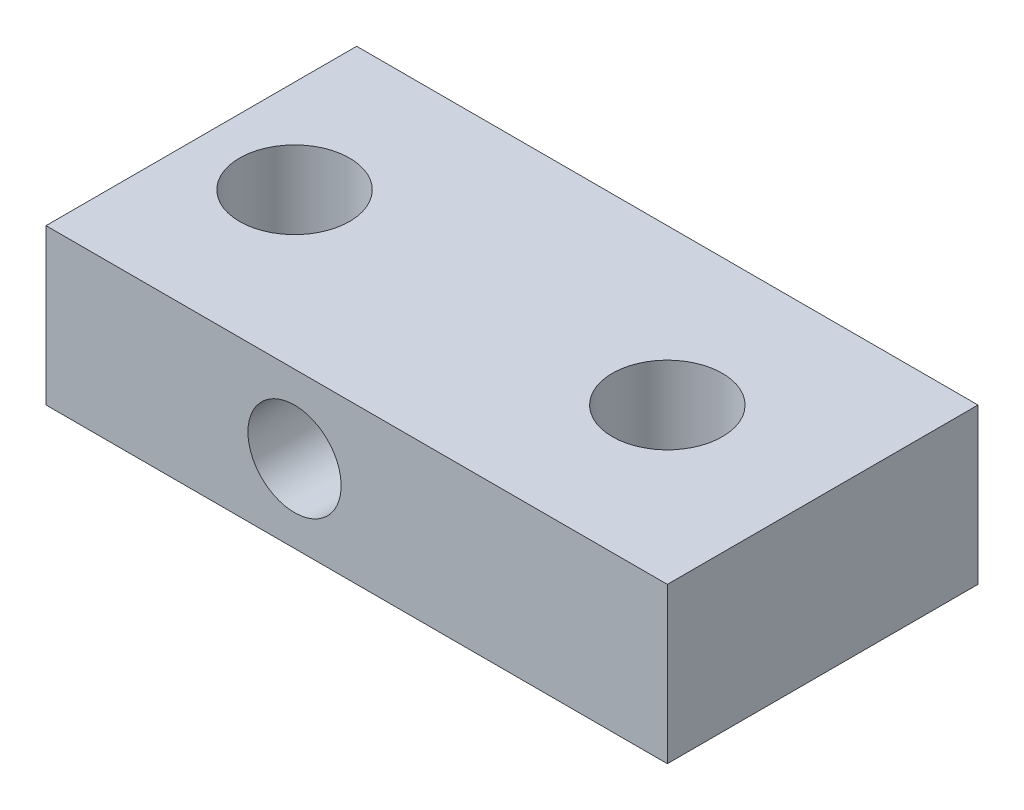
from build123d import *

# Parameters (mm, degrees)
SKETCH1_W             = 25.4
SKETCH1_H             = 12.7
BOSS_EXTRUDE1_DEPTH   = 6.35
SKETCH2_R             = 1.905
CUT_EXTRUDE1_DEPTH    = 20.05
F_8_CLEARANCE_HOLE1_D = 4.4958


with BuildPart() as part:
    # Sketch1 → Boss-Extrude1 (new body)
    with BuildSketch(Plane(origin=(0, 0, 0), x_dir=(1, 0, 0), z_dir=(0, 1, 0))):
        Rectangle(SKETCH1_W, SKETCH1_H)
    extrude(amount=BOSS_EXTRUDE1_DEPTH)

    # Sketch2 → Cut-Extrude1 (cut, through all)
    with BuildSketch(Plane(origin=(0, 0, -6.35), x_dir=(-1, 0, 0), z_dir=(0, 0, -1))):
        with Locations((2.54, 3.175)):
            Circle(SKETCH2_R)
    extrude(amount=-CUT_EXTRUDE1_DEPTH, mode=Mode.SUBTRACT)

    # #8 Clearance Hole1 (through all)
    with Locations(Plane(origin=(0, 6.35, 0), x_dir=(1, 0, 0), z_dir=(0, 1, 0))):
        with Locations((6.35, 0), (-8.89, 0)):
            Hole(F_8_CLEARANCE_HOLE1_D / 2)


solid = part.part
